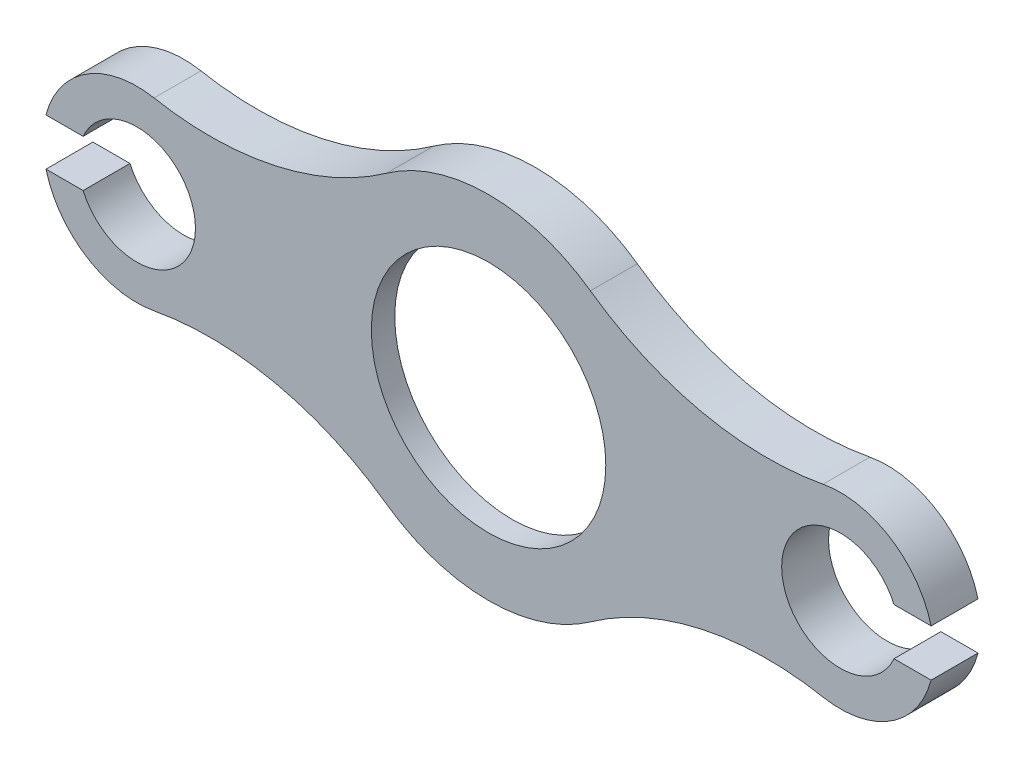
from build123d import *

# Parameters (mm, degrees)
ESQUISSE1_R        = 67.8
BOSS_EXTRU_1_DEPTH = 20
BOSS_EXTRU_3_START = 10
ESQUISSE1_4_R      = 67.8
ESQUISSE1_4_R_2    = 50
BOSS_EXTRU_3_DEPTH = 10


with BuildPart() as part:
    # Esquisse1 → Boss.-Extru.1 (new body)
    with BuildSketch(Plane.XY):
        with BuildLine():
            ThreePointArc((172.912878475, -10), (125, 0), (172.912878475, 10))
            Line((172.912878475, 10), (188.729833462, 10))
            ThreePointArc((188.729833462, 10), (171.474610109, 33.746720147), (142.654645502, 39.319788495))
            ThreePointArc((142.654645502, 39.319788495), (90.826496942, 40.144249625), (43.435338844, 61.142222232))
            ThreePointArc((43.435338844, 61.142222232), (0, 75), (-43.435338844, 61.142222232))
            ThreePointArc((-43.435338844, 61.142222232), (-90.826496942, 40.144249625), (-142.654645502, 39.319788495))
            ThreePointArc((-142.654645502, 39.319788495), (-171.474610109, 33.746720147), (-188.729833462, 10))
            Line((-188.729833462, 10), (-172.912878475, 10))
            ThreePointArc((-172.912878475, 10), (-125, 0), (-172.912878475, -10))
            Line((-172.912878475, -10), (-188.729833462, -10))
            ThreePointArc((-188.729833462, -10), (-171.474610109, -33.746720147), (-142.654645502, -39.319788495))
            ThreePointArc((-142.654645502, -39.319788495), (-90.826496942, -40.144249625), (-43.435338844, -61.142222232))
            ThreePointArc((-43.435338844, -61.142222232), (0, -75), (43.435338844, -61.142222232))
            ThreePointArc((43.435338844, -61.142222232), (90.826496942, -40.144249625), (142.654645502, -39.319788495))
            ThreePointArc((142.654645502, -39.319788495), (171.474610109, -33.746720147), (188.729833462, -10))
            Line((188.729833462, -10), (172.912878475, -10))
        make_face()
        Circle(ESQUISSE1_R, mode=Mode.SUBTRACT)
    extrude(amount=BOSS_EXTRU_1_DEPTH)

    # Esquisse1<4> → Boss.-Extru.3 (add)
    with BuildSketch(Plane.XY.offset(BOSS_EXTRU_3_START)):
        Circle(ESQUISSE1_4_R)
        Circle(ESQUISSE1_4_R_2, mode=Mode.SUBTRACT)
    extrude(amount=BOSS_EXTRU_3_DEPTH)


solid = part.part
